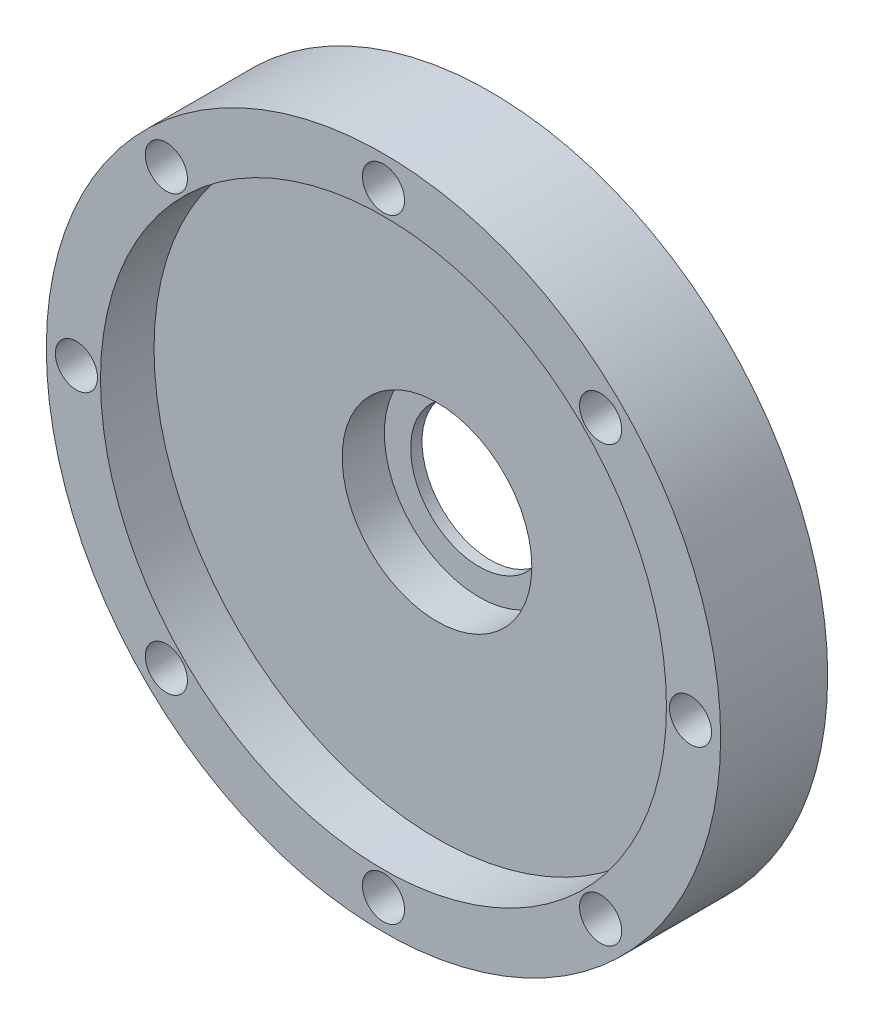
from build123d import *

# Parameters (mm, degrees)
SKETCH1_R           = 32.004
BOSS_EXTRUDE1_DEPTH = 10.16
SKETCH2_R           = 26.8605
CUT_EXTRUDE1_DEPTH  = 5.08
SKETCH3_R           = 9
CUT_EXTRUDE2_DEPTH  = 4
SKETCH4_R           = 6.5
CUT_EXTRUDE3_DEPTH  = 47.162305315
SKETCH5_R           = 2
CUT_EXTRUDE4_DEPTH  = 47.386826061


with BuildPart() as part:
    # Sketch1 → Boss-Extrude1 (new body)
    with BuildSketch(Plane.XY):
        Circle(SKETCH1_R)
    extrude(amount=BOSS_EXTRUDE1_DEPTH)

    # Sketch2 → Cut-Extrude1 (cut)
    with BuildSketch(Plane.XY.offset(10.16)):
        Circle(SKETCH2_R)
    extrude(amount=-CUT_EXTRUDE1_DEPTH, mode=Mode.SUBTRACT)

    # Sketch3 → Cut-Extrude2 (cut)
    with BuildSketch(Plane.XY.offset(5.08)):
        Circle(SKETCH3_R)
    extrude(amount=-CUT_EXTRUDE2_DEPTH, mode=Mode.SUBTRACT)

    # Sketch4 → Cut-Extrude3 (cut, through all)
    with BuildSketch(Plane.XY.offset(1.08)):
        Circle(SKETCH4_R)
    extrude(amount=-CUT_EXTRUDE3_DEPTH, mode=Mode.SUBTRACT)

    # Sketch5 → Cut-Extrude4 (cut, through all)
    with BuildSketch(Plane.XY.offset(10.16)):
        with Locations((0, 29.1465)):
            Circle(SKETCH5_R)
        with Locations((20.609687798, 20.609687798)):
            Circle(SKETCH5_R)
        with Locations((29.1465, 0)):
            Circle(SKETCH5_R)
        with Locations((20.609687798, -20.609687798)):
            Circle(SKETCH5_R)
        with Locations((0, -29.1465)):
            Circle(SKETCH5_R)
        with Locations((-20.609687798, -20.609687798)):
            Circle(SKETCH5_R)
        with Locations((-29.1465, 0)):
            Circle(SKETCH5_R)
        with Locations((-20.609687798, 20.609687798)):
            Circle(SKETCH5_R)
    extrude(amount=-CUT_EXTRUDE4_DEPTH, mode=Mode.SUBTRACT)


solid = part.part
